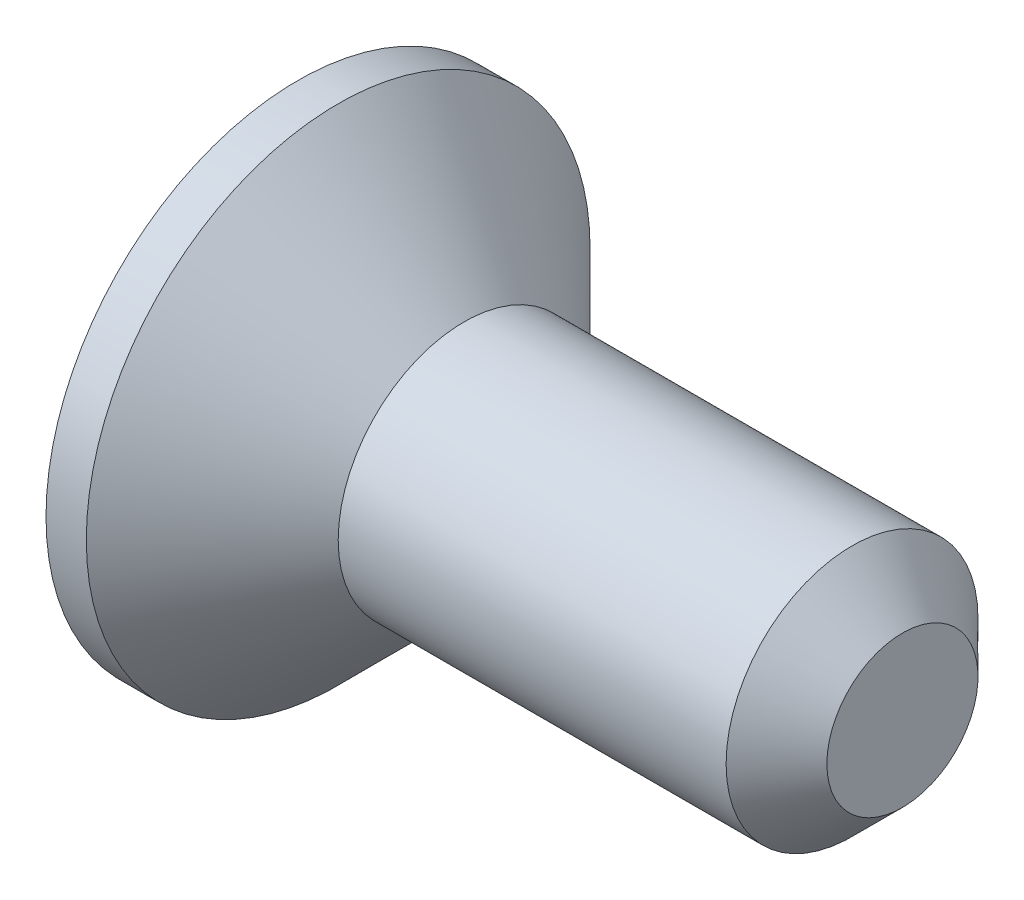
from build123d import *

# Parameters (mm, degrees)
CUT_EXTRUDE1_DEPTH = 0.8


with BuildPart() as part:
    # Sketch2 → Revolve1 (revolve)
    with BuildSketch(Plane.XY):
        Polygon((0, 0), (0, 2.5), (0.4, 2.5), (1.65, 1.25), (5.5, 1.25), (6, 0.75), (6, 0), align=None)
    revolve(axis=Axis((-2.281841559, 0, 0), (1, 0, 0)))

    # Sketch3 → Cut-Extrude1 (cut)
    with BuildSketch(Plane.ZY):
        Polygon((0.433012702, -0.75), (0.866025404, 0), (0.433012702, 0.75), (-0.433012702, 0.75), (-0.866025404, 0), (-0.433012702, -0.75), align=None)
    extrude(amount=-CUT_EXTRUDE1_DEPTH, mode=Mode.SUBTRACT)


solid = part.part
